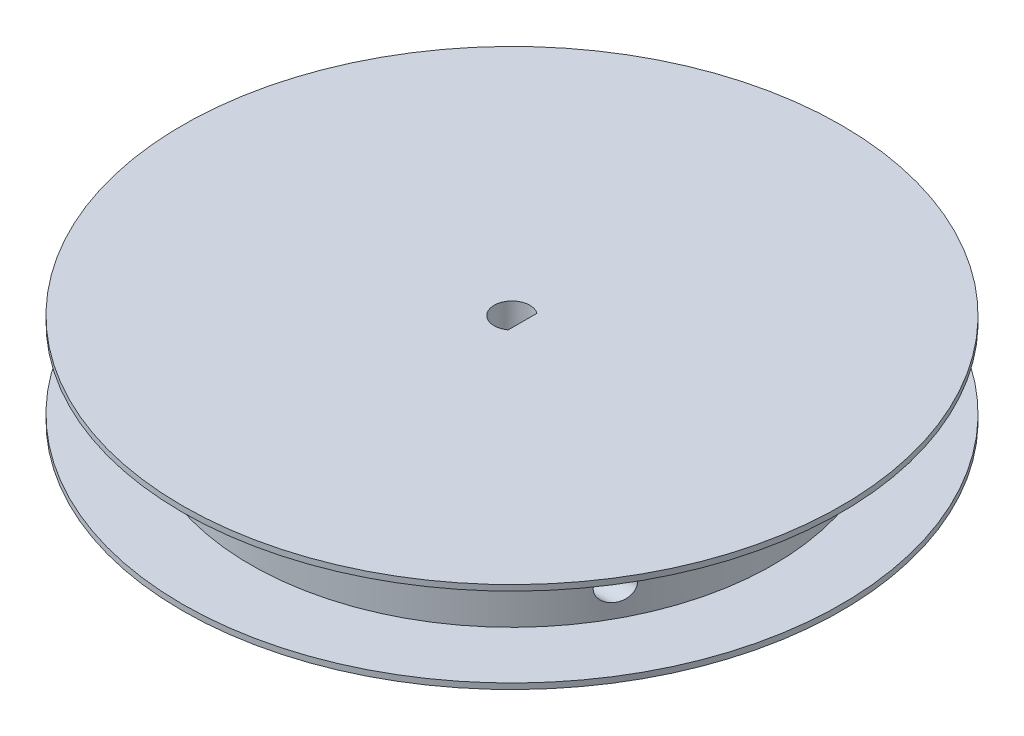
from build123d import *

# Parameters (mm, degrees)
SKETCH_1_R          = 9
EXTRUDE_1_DEPTH     = 8
CUT_EXTRUDE_1_DEPTH = 16.033296378
EXTRUDE_START       = -8
SKETCH_7_R          = 23
SKETCH_7_R_2        = 9
EXTRUDE_2_DEPTH     = 8
SKETCH_8_R          = 29
SKETCH_8_R_2        = 23
EXTRUDE_3_DEPTH     = 0.5
EXTRUDE_START_2     = -0.5
SKETCH_9_R          = 29
SKETCH_9_R_2        = 23
EXTRUDE_4_DEPTH     = 0.5
SKETCH_10_R         = 1.25977889
CUT_EXTRUDE_2_DEPTH = 25


with BuildPart() as part:
    # 草圖1 → 填料-伸長1 (new body)
    with BuildSketch(Plane(origin=(0, 0, 0), x_dir=(1, 0, 0), z_dir=(0, 1, 0))):
        Circle(SKETCH_1_R)
    extrude(amount=-EXTRUDE_1_DEPTH)

    # 草圖2 → 除料-伸長1 (cut, through all)
    with BuildSketch(Plane(origin=(0, -8, 0), x_dir=(-1, 0, 0), z_dir=(0, -1, 0))):
        with BuildLine():
            Line((-0.93, 1.264911064), (-0.93, -1.264911064))
            ThreePointArc((-0.93, -1.264911064), (0.708801806, -1.400892573), (1.57, 0))
            ThreePointArc((1.57, 0), (0.708801806, 1.400892573), (-0.93, 1.264911064))
        make_face()
    extrude(amount=-CUT_EXTRUDE_1_DEPTH, mode=Mode.SUBTRACT)

    # 草圖7 → 填料-伸長2 (add)
    with BuildSketch(Plane(origin=(0, -8, 0), x_dir=(-1, 0, 0), z_dir=(0, -1, 0)).offset(EXTRUDE_START)):
        Circle(SKETCH_7_R)
        Circle(SKETCH_7_R_2, mode=Mode.SUBTRACT)
    extrude(amount=EXTRUDE_2_DEPTH)

    # 草圖8 → 填料-伸長3 (add)
    with BuildSketch(Plane(origin=(0, 0, 0), x_dir=(1, 0, 0), z_dir=(0, 1, 0))):
        Circle(SKETCH_8_R)
        Circle(SKETCH_8_R_2, mode=Mode.SUBTRACT)
    extrude(amount=-EXTRUDE_3_DEPTH)

    # 草圖9 → 填料-伸長4 (add)
    with BuildSketch(Plane.XZ.offset(8).offset(EXTRUDE_START_2)):
        Circle(SKETCH_9_R)
        Circle(SKETCH_9_R_2, mode=Mode.SUBTRACT)
    extrude(amount=EXTRUDE_4_DEPTH)

    # 草圖10 → 除料-伸長2 (cut, symmetric)
    with BuildSketch(Plane(origin=(0, 0, 0), x_dir=(0, 0, -1), z_dir=(1, 0, 0))):
        with Locations((-11.0333289, -4.987601344)):
            Circle(SKETCH_10_R)
    extrude(amount=CUT_EXTRUDE_2_DEPTH, both=True, mode=Mode.SUBTRACT)


solid = part.part
